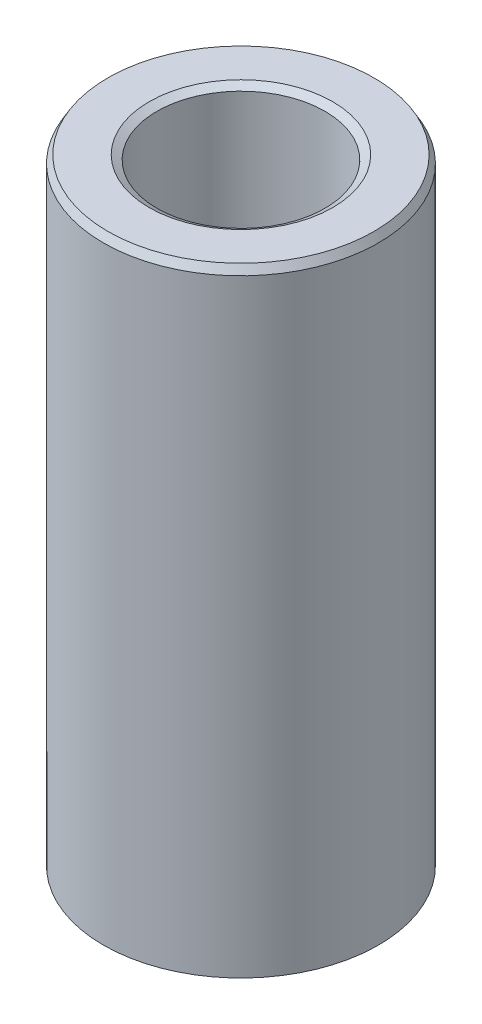
from build123d import *
from OCP.BRepFilletAPI import BRepFilletAPI_MakeChamfer

# Parameters (mm, degrees)
SKETCH1_R           = 12.5
BOSS_EXTRUDE1_DEPTH = 56.384881763
SKETCH2_R           = 7.640706538
CUT_EXTRUDE1_DEPTH  = 60.091072857
CHAMFER1_SIZE       = 0.700736508
CHAMFER1_SIZE2      = 0.404570412


with BuildPart() as part:
    # Sketch1 → Boss-Extrude1 (new body)
    with BuildSketch(Plane(origin=(0, 0, 0), x_dir=(1, 0, 0), z_dir=(0, 1, 0))):
        Circle(SKETCH1_R)
    extrude(amount=BOSS_EXTRUDE1_DEPTH)

    # Sketch2 → Cut-Extrude1 (cut, through all)
    with BuildSketch(Plane(origin=(0, 0, 0), x_dir=(1, 0, 0), z_dir=(0, 1, 0))):
        Circle(SKETCH2_R)
    extrude(amount=CUT_EXTRUDE1_DEPTH, mode=Mode.SUBTRACT)

    # Chamfer1: one chamfer whose edges measure the first distance from different faces: ONE call of the kernel's chamfer builder (chamfer() names one face for all edges)
    chamfer1_edges_1 = [part.edges().sort_by_distance(p)[0] for p in [
        (-7.640706538, 56.384881763, 0),
    ]]
    chamfer1_side_1 = [part.faces().sort_by_distance(p)[0] for p in [
        (-12.146446609, 56.384881763, 0),
    ]]
    chamfer1_edges_2 = [part.edges().sort_by_distance(p)[0] for p in [
        (-7.640706538, 0, 0),
    ]]
    chamfer1_side_2 = [part.faces().sort_by_distance(p)[0] for p in [
        (-7.640706538, 28.192440881, 0),
    ]]
    chamfer1_edges_3 = [part.edges().sort_by_distance(p)[0] for p in [
        (-12.5, 0, 0),
    ]]
    chamfer1_side_3 = [part.faces().sort_by_distance(p)[0] for p in [
        (-12.146446609, 0, 0),
    ]]
    chamfer1_edges_4 = [part.edges().sort_by_distance(p)[0] for p in [
        (-12.5, 56.384881763, 0),
    ]]
    chamfer1_side_4 = [part.faces().sort_by_distance(p)[0] for p in [
        (-12.5, 28.192440881, 0),
    ]]
    chamfer1 = BRepFilletAPI_MakeChamfer(part.part.solid().wrapped)
    for e in chamfer1_edges_1:
        chamfer1.Add(CHAMFER1_SIZE, CHAMFER1_SIZE2, e.wrapped, chamfer1_side_1[0].wrapped)  # the first distance lies on this face
    for e in chamfer1_edges_2:
        chamfer1.Add(CHAMFER1_SIZE, CHAMFER1_SIZE2, e.wrapped, chamfer1_side_2[0].wrapped)  # the first distance lies on this face
    for e in chamfer1_edges_3:
        chamfer1.Add(CHAMFER1_SIZE, CHAMFER1_SIZE2, e.wrapped, chamfer1_side_3[0].wrapped)  # the first distance lies on this face
    for e in chamfer1_edges_4:
        chamfer1.Add(CHAMFER1_SIZE, CHAMFER1_SIZE2, e.wrapped, chamfer1_side_4[0].wrapped)  # the first distance lies on this face
    add(Compound.cast(chamfer1.Shape()), mode=Mode.REPLACE)


solid = part.part
